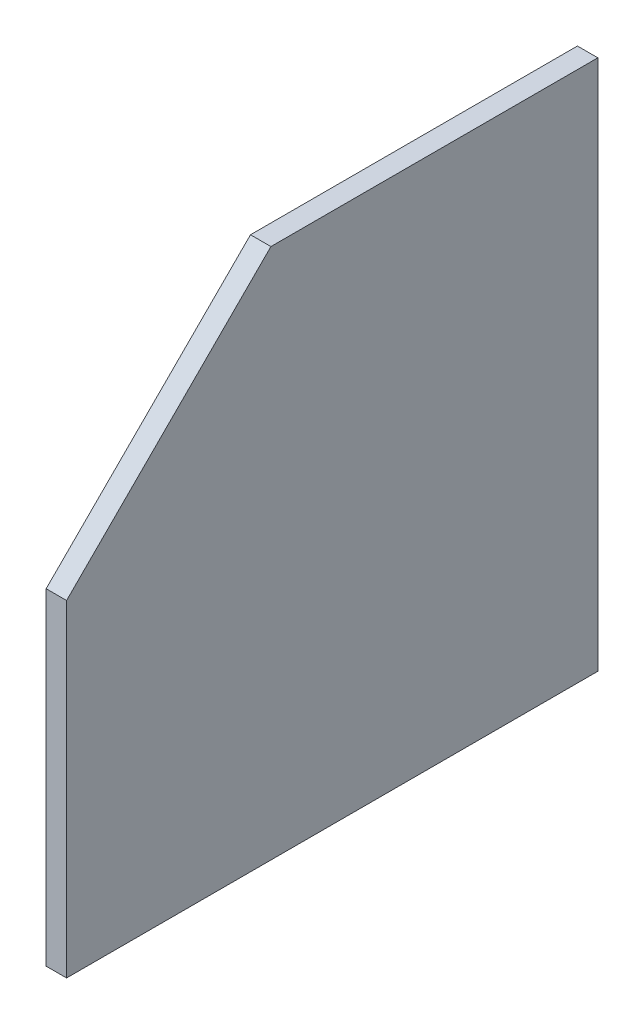
from build123d import *

# Parameters (mm, degrees)
BOSS_EXTRUDE1_DEPTH = 3.175


with BuildPart() as part:
    # Sketch1 → Boss-Extrude1 (new body)
    with BuildSketch(Plane(origin=(0, 0, 0), x_dir=(0, 0, -1), z_dir=(1, 0, 0))):
        Polygon((0, 0), (0, 82.55), (-50.8, 82.55), (-82.55, 50.8), (-82.55, 0), align=None)
    extrude(amount=BOSS_EXTRUDE1_DEPTH)


solid = part.part
